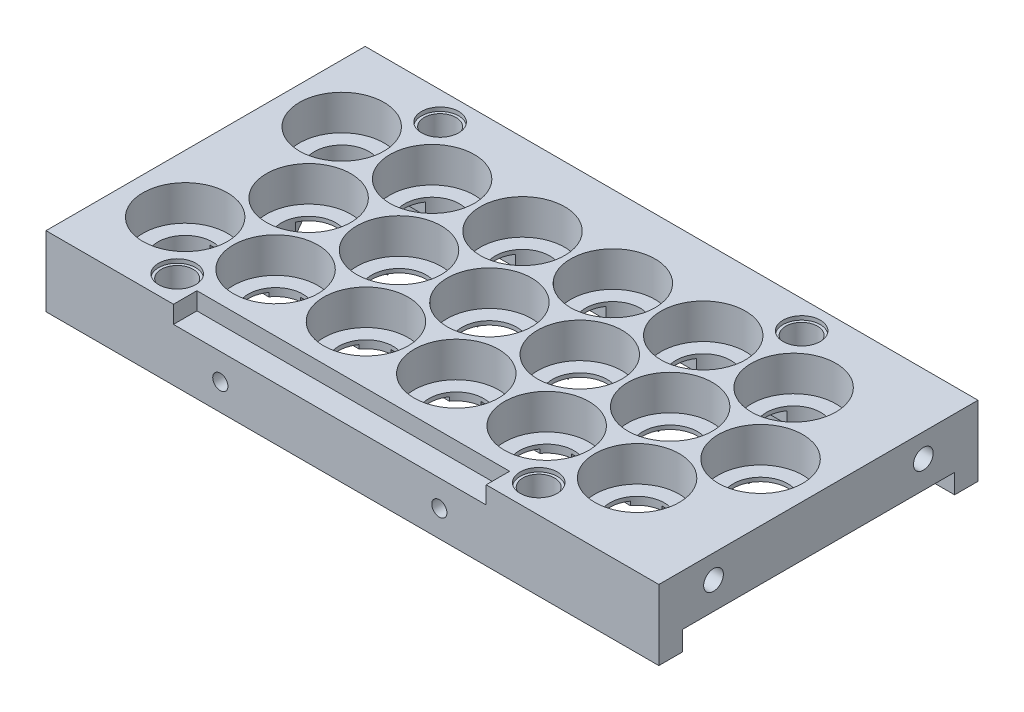
from build123d import *
from build123d.topology import SkipClean

# Parameters (mm, degrees)
SKETCH1_W            = 156.975
SKETCH1_H            = 81.746976195
SKETCH1_R            = 10.825
BOSS_EXTRUDE2_DEPTH  = 11
SKETCH1_3_R          = 10.825
SKETCH1_3_R_2        = 7
BOSS_EXTRUDE3_DEPTH  = 2
CUT_EXTRUDE1_DEPTH   = 1
CUT_EXTRUDE3_REACH   = 157.046
SKETCH9_R            = 4.0767
SKETCH10_R           = 4.7625
CUT_EXTRUDE4_DEPTH   = 1
SKETCH13_R           = 6.5
BOSS_EXTRUDE7_DEPTH  = 7
BOSS_EXTRUDE9_START  = 2
BOSS_EXTRUDE9_DEPTH  = 2
BOSS_EXTRUDE10_DEPTH = 2
SKETCH17_R           = 1.9431
CUT_EXTRUDE5_DEPTH   = 4
SKETCH19_W           = 80.1
SKETCH19_H           = 4.475
CUT_EXTRUDE6_DEPTH   = 6
SKETCH20_R           = 1.9431
CUT_EXTRUDE7_DEPTH   = 3.8862
SKETCH22_R           = 2.525
CUT_EXTRUDE8_DEPTH   = 3.81


with BuildPart() as part:
    # Sketch1 → Boss-Extrude2 (new body)
    with BuildSketch(Plane(origin=(0, 0, 0), x_dir=(1, 0, 0), z_dir=(0, 1, 0))):
        with Locations((63.6625, -20.048488098)):
            Rectangle(SKETCH1_W, SKETCH1_H)
        with Locations((0, -40.096976195)):
            Circle(SKETCH1_R, mode=Mode.SUBTRACT)
        with Locations((23.15, -40.096976195)):
            Circle(SKETCH1_R, mode=Mode.SUBTRACT)
        with Locations((46.3, -40.096976195)):
            Circle(SKETCH1_R, mode=Mode.SUBTRACT)
        with Locations((69.45, -40.096976195)):
            Circle(SKETCH1_R, mode=Mode.SUBTRACT)
        with Locations((92.6, -40.096976195)):
            Circle(SKETCH1_R, mode=Mode.SUBTRACT)
        with Locations((115.75, -40.096976195)):
            Circle(SKETCH1_R, mode=Mode.SUBTRACT)
        with Locations((11.575, -20.048488098)):
            Circle(SKETCH1_R, mode=Mode.SUBTRACT)
        Circle(SKETCH1_R, mode=Mode.SUBTRACT)
        with Locations((23.15, 0)):
            Circle(SKETCH1_R, mode=Mode.SUBTRACT)
        with Locations((34.725, -20.048488098)):
            Circle(SKETCH1_R, mode=Mode.SUBTRACT)
        with Locations((57.875, -20.048488098)):
            Circle(SKETCH1_R, mode=Mode.SUBTRACT)
        with Locations((46.3, 0)):
            Circle(SKETCH1_R, mode=Mode.SUBTRACT)
        with Locations((81.025, -20.048488098)):
            Circle(SKETCH1_R, mode=Mode.SUBTRACT)
        with Locations((69.45, 0)):
            Circle(SKETCH1_R, mode=Mode.SUBTRACT)
        with Locations((92.6, 0)):
            Circle(SKETCH1_R, mode=Mode.SUBTRACT)
        with Locations((104.175, -20.048488098)):
            Circle(SKETCH1_R, mode=Mode.SUBTRACT)
        with Locations((127.325, -20.048488098)):
            Circle(SKETCH1_R, mode=Mode.SUBTRACT)
        with Locations((115.75, 0)):
            Circle(SKETCH1_R, mode=Mode.SUBTRACT)
    extrude(amount=BOSS_EXTRUDE2_DEPTH)

    # Sketch1<3> → Boss-Extrude3 (add)
    # profile 1 of 18: a face of its own
    with BuildSketch(Plane(origin=(0, 0, 0), x_dir=(1, 0, 0), z_dir=(0, 1, 0))):
        Circle(SKETCH1_3_R)
        Circle(SKETCH1_3_R_2, mode=Mode.SUBTRACT)
    # profile 2 of 18: a face of its own
    with BuildSketch(Plane(origin=(0, 0, 0), x_dir=(1, 0, 0), z_dir=(0, 1, 0))):
        with Locations((11.575, -20.048488098)):
            Circle(SKETCH1_3_R)
        with Locations((11.575, -20.048488098)):
            Circle(SKETCH1_3_R_2, mode=Mode.SUBTRACT)
    # profile 3 of 18: a face of its own
    with BuildSketch(Plane(origin=(0, 0, 0), x_dir=(1, 0, 0), z_dir=(0, 1, 0))):
        with Locations((0, -40.096976195)):
            Circle(SKETCH1_3_R)
        with Locations((0, -40.096976195)):
            Circle(SKETCH1_3_R_2, mode=Mode.SUBTRACT)
    # profile 4 of 18: a face of its own
    with BuildSketch(Plane(origin=(0, 0, 0), x_dir=(1, 0, 0), z_dir=(0, 1, 0))):
        with Locations((23.15, 0)):
            Circle(SKETCH1_3_R)
        with Locations((23.15, 0)):
            Circle(SKETCH1_3_R_2, mode=Mode.SUBTRACT)
    # profile 5 of 18: a face of its own
    with BuildSketch(Plane(origin=(0, 0, 0), x_dir=(1, 0, 0), z_dir=(0, 1, 0))):
        with Locations((34.725, -20.048488098)):
            Circle(SKETCH1_3_R)
        with Locations((34.725, -20.048488098)):
            Circle(SKETCH1_3_R_2, mode=Mode.SUBTRACT)
    # profile 6 of 18: a face of its own
    with BuildSketch(Plane(origin=(0, 0, 0), x_dir=(1, 0, 0), z_dir=(0, 1, 0))):
        with Locations((23.15, -40.096976195)):
            Circle(SKETCH1_3_R)
        with Locations((23.15, -40.096976195)):
            Circle(SKETCH1_3_R_2, mode=Mode.SUBTRACT)
    # profile 7 of 18: a face of its own
    with BuildSketch(Plane(origin=(0, 0, 0), x_dir=(1, 0, 0), z_dir=(0, 1, 0))):
        with Locations((46.3, 0)):
            Circle(SKETCH1_3_R)
        with Locations((46.3, 0)):
            Circle(SKETCH1_3_R_2, mode=Mode.SUBTRACT)
    # profile 8 of 18: a face of its own
    with BuildSketch(Plane(origin=(0, 0, 0), x_dir=(1, 0, 0), z_dir=(0, 1, 0))):
        with Locations((57.875, -20.048488098)):
            Circle(SKETCH1_3_R)
        with Locations((57.875, -20.048488098)):
            Circle(SKETCH1_3_R_2, mode=Mode.SUBTRACT)
    # profile 9 of 18: a face of its own
    with BuildSketch(Plane(origin=(0, 0, 0), x_dir=(1, 0, 0), z_dir=(0, 1, 0))):
        with Locations((46.3, -40.096976195)):
            Circle(SKETCH1_3_R)
        with Locations((46.3, -40.096976195)):
            Circle(SKETCH1_3_R_2, mode=Mode.SUBTRACT)
    # profile 10 of 18: a face of its own
    with BuildSketch(Plane(origin=(0, 0, 0), x_dir=(1, 0, 0), z_dir=(0, 1, 0))):
        with Locations((69.45, 0)):
            Circle(SKETCH1_3_R)
        with Locations((69.45, 0)):
            Circle(SKETCH1_3_R_2, mode=Mode.SUBTRACT)
    # profile 11 of 18: a face of its own
    with BuildSketch(Plane(origin=(0, 0, 0), x_dir=(1, 0, 0), z_dir=(0, 1, 0))):
        with Locations((81.025, -20.048488098)):
            Circle(SKETCH1_3_R)
        with Locations((81.025, -20.048488098)):
            Circle(SKETCH1_3_R_2, mode=Mode.SUBTRACT)
    # profile 12 of 18: a face of its own
    with BuildSketch(Plane(origin=(0, 0, 0), x_dir=(1, 0, 0), z_dir=(0, 1, 0))):
        with Locations((69.45, -40.096976195)):
            Circle(SKETCH1_3_R)
        with Locations((69.45, -40.096976195)):
            Circle(SKETCH1_3_R_2, mode=Mode.SUBTRACT)
    # profile 13 of 18: a face of its own
    with BuildSketch(Plane(origin=(0, 0, 0), x_dir=(1, 0, 0), z_dir=(0, 1, 0))):
        with Locations((92.6, 0)):
            Circle(SKETCH1_3_R)
        with Locations((92.6, 0)):
            Circle(SKETCH1_3_R_2, mode=Mode.SUBTRACT)
    # profile 14 of 18: a face of its own
    with BuildSketch(Plane(origin=(0, 0, 0), x_dir=(1, 0, 0), z_dir=(0, 1, 0))):
        with Locations((104.175, -20.048488098)):
            Circle(SKETCH1_3_R)
        with Locations((104.175, -20.048488098)):
            Circle(SKETCH1_3_R_2, mode=Mode.SUBTRACT)
    # profile 15 of 18: a face of its own
    with BuildSketch(Plane(origin=(0, 0, 0), x_dir=(1, 0, 0), z_dir=(0, 1, 0))):
        with Locations((92.6, -40.096976195)):
            Circle(SKETCH1_3_R)
        with Locations((92.6, -40.096976195)):
            Circle(SKETCH1_3_R_2, mode=Mode.SUBTRACT)
    # profile 16 of 18: a face of its own
    with BuildSketch(Plane(origin=(0, 0, 0), x_dir=(1, 0, 0), z_dir=(0, 1, 0))):
        with Locations((115.75, 0)):
            Circle(SKETCH1_3_R)
        with Locations((115.75, 0)):
            Circle(SKETCH1_3_R_2, mode=Mode.SUBTRACT)
    # profile 17 of 18: a face of its own
    with BuildSketch(Plane(origin=(0, 0, 0), x_dir=(1, 0, 0), z_dir=(0, 1, 0))):
        with Locations((127.325, -20.048488098)):
            Circle(SKETCH1_3_R)
        with Locations((127.325, -20.048488098)):
            Circle(SKETCH1_3_R_2, mode=Mode.SUBTRACT)
    # profile 18 of 18: a face of its own
    with BuildSketch(Plane(origin=(0, 0, 0), x_dir=(1, 0, 0), z_dir=(0, 1, 0))):
        with Locations((115.75, -40.096976195)):
            Circle(SKETCH1_3_R)
        with Locations((115.75, -40.096976195)):
            Circle(SKETCH1_3_R_2, mode=Mode.SUBTRACT)
    extrude(amount=BOSS_EXTRUDE3_DEPTH)

    # Sketch2 → Cut-Extrude1 (cut)
    with BuildSketch(Plane.XZ):
        with BuildLine():
            Line((-0.591820292, 33.12203901), (5.238617062, 23.023425283))
            ThreePointArc((5.238617062, 23.023425283), (8.075, 26.110665924), (12.166820292, 27.023425283))
            Line((12.166820292, 27.023425283), (6.92820323, 36.096976195))
            Line((6.92820323, 36.096976195), (17.405437353, 36.096976195))
            ThreePointArc((17.405437353, 36.096976195), (16.15, 40.096976195), (17.405437353, 44.096976195))
            Line((17.405437353, 44.096976195), (5.744562647, 44.096976195))
            ThreePointArc((5.744562647, 44.096976195), (6.062177826, 36.596976195), (-0.591820292, 33.12203901))
        make_face()
        with BuildLine():
            Line((27.79679677, 24.048488098), (17.319562647, 24.048488098))
            ThreePointArc((17.319562647, 24.048488098), (18.575, 20.048488098), (17.319562647, 16.048488098))
            Line((17.319562647, 16.048488098), (27.79679677, 16.048488098))
            Line((27.79679677, 16.048488098), (22.558179708, 6.974937186))
            ThreePointArc((22.558179708, 6.974937186), (26.124937186, 6.336382938), (28.894562647, 4))
            Line((28.894562647, 4), (6.92820323, 4))
            Line((6.92820323, 4), (12.166820292, 13.073550912))
            ThreePointArc((12.166820292, 13.073550912), (8.075, 13.986310271), (5.238617062, 17.073550912))
            Line((5.238617062, 17.073550912), (-0.591820292, 6.974937186))
            ThreePointArc((-0.591820292, 6.974937186), (2.974937186, 6.336382938), (5.744562647, 4))
            Line((5.744562647, 4), (0, 4))
            ThreePointArc((0, 4), (-4, 0), (0, -4))
            Line((0, -4), (115.75, -4))
            ThreePointArc((115.75, -4), (119.75, 0), (115.75, 4))
            Line((115.75, 4), (99.52820323, 4))
            Line((99.52820323, 4), (104.766820292, 13.073550912))
            ThreePointArc((104.766820292, 13.073550912), (97.175, 20.048488098), (104.766820292, 27.023425283))
            Line((104.766820292, 27.023425283), (99.52820323, 36.096976195))
            Line((99.52820323, 36.096976195), (110.005437353, 36.096976195))
            ThreePointArc((110.005437353, 36.096976195), (108.75, 40.096976195), (110.005437353, 44.096976195))
            Line((110.005437353, 44.096976195), (98.344562647, 44.096976195))
            ThreePointArc((98.344562647, 44.096976195), (98.662177826, 36.596976195), (92.008179708, 33.12203901))
            Line((92.008179708, 33.12203901), (97.24679677, 24.048488098))
            Line((97.24679677, 24.048488098), (86.769562647, 24.048488098))
            ThreePointArc((86.769562647, 24.048488098), (88.025, 20.048488098), (86.769562647, 16.048488098))
            Line((86.769562647, 16.048488098), (97.24679677, 16.048488098))
            Line((97.24679677, 16.048488098), (92.008179708, 6.974937186))
            ThreePointArc((92.008179708, 6.974937186), (95.574937186, 6.336382938), (98.344562647, 4))
            Line((98.344562647, 4), (76.37820323, 4))
            Line((76.37820323, 4), (81.616820292, 13.073550912))
            ThreePointArc((81.616820292, 13.073550912), (74.025, 20.048488098), (81.616820292, 27.023425283))
            Line((81.616820292, 27.023425283), (76.37820323, 36.096976195))
            Line((76.37820323, 36.096976195), (86.855437353, 36.096976195))
            ThreePointArc((86.855437353, 36.096976195), (85.6, 40.096976195), (86.855437353, 44.096976195))
            Line((86.855437353, 44.096976195), (75.194562647, 44.096976195))
            ThreePointArc((75.194562647, 44.096976195), (75.512177826, 36.596976195), (68.858179708, 33.12203901))
            Line((68.858179708, 33.12203901), (74.09679677, 24.048488098))
            Line((74.09679677, 24.048488098), (63.619562647, 24.048488098))
            ThreePointArc((63.619562647, 24.048488098), (64.875, 20.048488098), (63.619562647, 16.048488098))
            Line((63.619562647, 16.048488098), (74.09679677, 16.048488098))
            Line((74.09679677, 16.048488098), (68.858179708, 6.974937186))
            ThreePointArc((68.858179708, 6.974937186), (72.424937186, 6.336382938), (75.194562647, 4))
            Line((75.194562647, 4), (53.22820323, 4))
            Line((53.22820323, 4), (58.466820292, 13.073550912))
            ThreePointArc((58.466820292, 13.073550912), (50.875, 20.048488098), (58.466820292, 27.023425283))
            Line((58.466820292, 27.023425283), (53.22820323, 36.096976195))
            Line((53.22820323, 36.096976195), (63.705437353, 36.096976195))
            ThreePointArc((63.705437353, 36.096976195), (62.45, 40.096976195), (63.705437353, 44.096976195))
            Line((63.705437353, 44.096976195), (52.044562647, 44.096976195))
            ThreePointArc((52.044562647, 44.096976195), (52.362177826, 36.596976195), (45.708179708, 33.12203901))
            Line((45.708179708, 33.12203901), (50.94679677, 24.048488098))
            Line((50.94679677, 24.048488098), (40.469562647, 24.048488098))
            ThreePointArc((40.469562647, 24.048488098), (41.725, 20.048488098), (40.469562647, 16.048488098))
            Line((40.469562647, 16.048488098), (50.94679677, 16.048488098))
            Line((50.94679677, 16.048488098), (45.708179708, 6.974937186))
            ThreePointArc((45.708179708, 6.974937186), (49.274937186, 6.336382938), (52.044562647, 4))
            Line((52.044562647, 4), (30.07820323, 4))
            Line((30.07820323, 4), (35.316820292, 13.073550912))
            ThreePointArc((35.316820292, 13.073550912), (27.725, 20.048488098), (35.316820292, 27.023425283))
            Line((35.316820292, 27.023425283), (30.07820323, 36.096976195))
            Line((30.07820323, 36.096976195), (40.555437353, 36.096976195))
            ThreePointArc((40.555437353, 36.096976195), (39.3, 40.096976195), (40.555437353, 44.096976195))
            Line((40.555437353, 44.096976195), (28.894562647, 44.096976195))
            ThreePointArc((28.894562647, 44.096976195), (29.212177826, 36.596976195), (22.558179708, 33.12203901))
            Line((22.558179708, 33.12203901), (27.79679677, 24.048488098))
        make_face()
        with BuildLine():
            Line((127.916820292, 27.023425283), (122.086382938, 37.12203901))
            ThreePointArc((122.086382938, 37.12203901), (119.25, 34.034798369), (115.158179708, 33.12203901))
            Line((115.158179708, 33.12203901), (120.39679677, 24.048488098))
            Line((120.39679677, 24.048488098), (109.919562647, 24.048488098))
            ThreePointArc((109.919562647, 24.048488098), (111.175, 20.048488098), (109.919562647, 16.048488098))
            Line((109.919562647, 16.048488098), (120.39679677, 16.048488098))
            Line((120.39679677, 16.048488098), (115.158179708, 6.974937186))
            ThreePointArc((115.158179708, 6.974937186), (119.25, 6.062177826), (122.086382938, 2.974937186))
            Line((122.086382938, 2.974937186), (127.916820292, 13.073550912))
            ThreePointArc((127.916820292, 13.073550912), (120.325, 20.048488098), (127.916820292, 27.023425283))
        make_face()
    extrude(amount=-CUT_EXTRUDE1_DEPTH, mode=Mode.SUBTRACT)

    # Sketch9 → Cut-Extrude3 (cut, up to next)
    with BuildSketch(Plane(origin=(0, 11, 0), x_dir=(1, 0, 0), z_dir=(0, 1, 0)), mode=Mode.PRIVATE) as cut_extrude3_sk1:
        with Locations((11.575, 13.625)):
            Circle(SKETCH9_R)
    cut_extrude3_tool1 = extrude(cut_extrude3_sk1.sketch, amount=-CUT_EXTRUDE3_REACH, mode=Mode.PRIVATE) & part.part
    # Sketch9 → Cut-Extrude3 (cut, up to next)
    with BuildSketch(Plane(origin=(0, 11, 0), x_dir=(1, 0, 0), z_dir=(0, 1, 0)), mode=Mode.PRIVATE) as cut_extrude3_sk2:
        with Locations((11.575, -53.721976195)):
            Circle(SKETCH9_R)
    cut_extrude3_tool2 = extrude(cut_extrude3_sk2.sketch, amount=-CUT_EXTRUDE3_REACH, mode=Mode.PRIVATE) & part.part
    # Sketch9 → Cut-Extrude3 (cut, up to next)
    with BuildSketch(Plane(origin=(0, 11, 0), x_dir=(1, 0, 0), z_dir=(0, 1, 0)), mode=Mode.PRIVATE) as cut_extrude3_sk3:
        with Locations((104.175, -53.721976195)):
            Circle(SKETCH9_R)
    cut_extrude3_tool3 = extrude(cut_extrude3_sk3.sketch, amount=-CUT_EXTRUDE3_REACH, mode=Mode.PRIVATE) & part.part
    # Sketch9 → Cut-Extrude3 (cut, up to next)
    with BuildSketch(Plane(origin=(0, 11, 0), x_dir=(1, 0, 0), z_dir=(0, 1, 0)), mode=Mode.PRIVATE) as cut_extrude3_sk4:
        with Locations((104.175, 13.625)):
            Circle(SKETCH9_R)
    cut_extrude3_tool4 = extrude(cut_extrude3_sk4.sketch, amount=-CUT_EXTRUDE3_REACH, mode=Mode.PRIVATE) & part.part
    add(cut_extrude3_tool1.solids().sort_by_distance((11.575, 11, -13.625))[0], mode=Mode.SUBTRACT)
    add(cut_extrude3_tool2.solids().sort_by_distance((11.575, 11, 53.721976))[0], mode=Mode.SUBTRACT)
    add(cut_extrude3_tool3.solids().sort_by_distance((104.175, 11, 53.721976))[0], mode=Mode.SUBTRACT)
    add(cut_extrude3_tool4.solids().sort_by_distance((104.175, 11, -13.625))[0], mode=Mode.SUBTRACT)

    # Sketch10 → Cut-Extrude4 (cut)
    with BuildSketch(Plane(origin=(0, 11, 0), x_dir=(1, 0, 0), z_dir=(0, 1, 0))):
        with Locations((11.575, 13.625)):
            Circle(SKETCH10_R)
        with Locations((104.175, 13.625)):
            Circle(SKETCH10_R)
        with Locations((104.175, -53.721976195)):
            Circle(SKETCH10_R)
        with Locations((11.575, -53.721976195)):
            Circle(SKETCH10_R)
    extrude(amount=-CUT_EXTRUDE4_DEPTH, mode=Mode.SUBTRACT)

    # Sketch13 → Boss-Extrude7 (add)
    # profile 1 of 2: a face of its own
    with BuildSketch(Plane.XZ):
        with BuildLine():
            ThreePointArc((3.665512027, 54.921976195), (11.575, 45.721976195), (19.484487973, 54.921976195))
            Line((19.484487973, 54.921976195), (96.265512027, 54.921976195))
            ThreePointArc((96.265512027, 54.921976195), (104.175, 45.721976195), (112.084487973, 54.921976195))
            Line((112.084487973, 54.921976195), (142.15, 54.921976195))
            Line((142.15, 54.921976195), (142.15, 60.921976195))
            Line((142.15, 60.921976195), (-14.825, 60.921976195))
            Line((-14.825, 60.921976195), (-14.825, 54.921976195))
            Line((-14.825, 54.921976195), (3.665512027, 54.921976195))
        make_face()
        with Locations((11.575, 53.721976195)):
            Circle(SKETCH13_R, mode=Mode.SUBTRACT)
        with Locations((104.175, 53.721976195)):
            Circle(SKETCH13_R, mode=Mode.SUBTRACT)
    # profile 2 of 2: a face of its own
    with BuildSketch(Plane.XZ):
        with BuildLine():
            Line((-14.825, -14.825), (-14.825, -20.825))
            Line((-14.825, -20.825), (142.15, -20.825))
            Line((142.15, -20.825), (142.15, -14.825))
            Line((142.15, -14.825), (112.084487973, -14.825))
            ThreePointArc((112.084487973, -14.825), (104.175, -5.625), (96.265512027, -14.825))
            Line((96.265512027, -14.825), (19.484487973, -14.825))
            ThreePointArc((19.484487973, -14.825), (11.575, -5.625), (3.665512027, -14.825))
            Line((3.665512027, -14.825), (-14.825, -14.825))
        make_face()
        with Locations((11.575, -13.625)):
            Circle(SKETCH13_R, mode=Mode.SUBTRACT)
        with Locations((104.175, -13.625)):
            Circle(SKETCH13_R, mode=Mode.SUBTRACT)
    extrude(amount=BOSS_EXTRUDE7_DEPTH)

    # Sketch14 → Boss-Extrude9 (add)
    with SkipClean():  # the faces are left unmerged after this step: merging them gives an invalid solid
        with BuildSketch(Plane.XZ.offset(BOSS_EXTRUDE9_START)):
            with BuildLine():
                Line((142.15, 54.921976195), (142.15, -14.825))
                Line((142.15, -14.825), (112.084487973, -14.825))
                ThreePointArc((112.084487973, -14.825), (104.175, -5.625), (96.265512027, -14.825))
                Line((96.265512027, -14.825), (19.484487973, -14.825))
                ThreePointArc((19.484487973, -14.825), (11.575, -5.625), (3.665512027, -14.825))
                Line((3.665512027, -14.825), (-14.825, -14.825))
                Line((-14.825, -14.825), (-14.825, 54.921976195))
                Line((-14.825, 54.921976195), (3.665512027, 54.921976195))
                ThreePointArc((3.665512027, 54.921976195), (11.575, 45.721976195), (19.484487973, 54.921976195))
                Line((19.484487973, 54.921976195), (96.265512027, 54.921976195))
                ThreePointArc((96.265512027, 54.921976195), (104.175, 45.721976195), (112.084487973, 54.921976195))
                Line((112.084487973, 54.921976195), (142.15, 54.921976195))
            make_face()
            with BuildLine():
                Line((5.238617062, 17.073550912), (-0.591820292, 6.974937186))
                ThreePointArc((-0.591820292, 6.974937186), (-6.062177826, -3.5), (5.744562647, -4))
                Line((5.744562647, -4), (17.405437353, -4))
                ThreePointArc((17.405437353, -4), (23.15, -7), (28.894562647, -4))
                Line((28.894562647, -4), (40.555437353, -4))
                ThreePointArc((40.555437353, -4), (46.3, -7), (52.044562647, -4))
                Line((52.044562647, -4), (63.705437353, -4))
                ThreePointArc((63.705437353, -4), (69.45, -7), (75.194562647, -4))
                Line((75.194562647, -4), (86.855437353, -4))
                ThreePointArc((86.855437353, -4), (92.6, -7), (98.344562647, -4))
                Line((98.344562647, -4), (110.005437353, -4))
                ThreePointArc((110.005437353, -4), (119.25, -6.062177826), (122.086382938, 2.974937186))
                Line((122.086382938, 2.974937186), (127.916820292, 13.073550912))
                ThreePointArc((127.916820292, 13.073550912), (134.325, 20.048488098), (127.916820292, 27.023425283))
                Line((127.916820292, 27.023425283), (122.086382938, 37.12203901))
                ThreePointArc((122.086382938, 37.12203901), (119.25, 46.159154022), (110.005437353, 44.096976195))
                Line((110.005437353, 44.096976195), (98.344562647, 44.096976195))
                ThreePointArc((98.344562647, 44.096976195), (92.6, 47.096976195), (86.855437353, 44.096976195))
                Line((86.855437353, 44.096976195), (75.194562647, 44.096976195))
                ThreePointArc((75.194562647, 44.096976195), (69.45, 47.096976195), (63.705437353, 44.096976195))
                Line((63.705437353, 44.096976195), (52.044562647, 44.096976195))
                ThreePointArc((52.044562647, 44.096976195), (46.3, 47.096976195), (40.555437353, 44.096976195))
                Line((40.555437353, 44.096976195), (28.894562647, 44.096976195))
                ThreePointArc((28.894562647, 44.096976195), (23.15, 47.096976195), (17.405437353, 44.096976195))
                Line((17.405437353, 44.096976195), (5.744562647, 44.096976195))
                ThreePointArc((5.744562647, 44.096976195), (-6.062177826, 43.596976195), (-0.591820292, 33.12203901))
                Line((-0.591820292, 33.12203901), (5.238617062, 23.023425283))
                ThreePointArc((5.238617062, 23.023425283), (4.575, 20.048488098), (5.238617062, 17.073550912))
            make_face(mode=Mode.SUBTRACT)
        extrude(amount=-BOSS_EXTRUDE9_DEPTH)

    # Sketch16 → Boss-Extrude10 (add)
    with SkipClean():  # the faces are left unmerged after this step: merging them gives an invalid solid
        with BuildSketch(Plane.XZ):
            with BuildLine():
                Line((15.536128823, 32.859238845), (20.688871177, 29.884301659))
                ThreePointArc((20.688871177, 29.884301659), (21.237909283, 27.835263554), (19.188871177, 27.286225448))
                Line((19.188871177, 27.286225448), (14.036128823, 30.261162634))
                ThreePointArc((14.036128823, 30.261162634), (13.487090717, 32.310200739), (15.536128823, 32.859238845))
            make_face()
            with BuildLine():
                Line((38.686128823, 32.859238845), (43.838871177, 29.884301659))
                ThreePointArc((43.838871177, 29.884301659), (44.387909283, 27.835263554), (42.338871177, 27.286225448))
                Line((42.338871177, 27.286225448), (37.186128823, 30.261162634))
                ThreePointArc((37.186128823, 30.261162634), (36.637090717, 32.310200739), (38.686128823, 32.859238845))
            make_face()
            with BuildLine():
                Line((61.836128823, 32.859238845), (66.988871177, 29.884301659))
                ThreePointArc((66.988871177, 29.884301659), (67.537909283, 27.835263554), (65.488871177, 27.286225448))
                Line((65.488871177, 27.286225448), (60.336128823, 30.261162634))
                ThreePointArc((60.336128823, 30.261162634), (59.787090717, 32.310200739), (61.836128823, 32.859238845))
            make_face()
            with BuildLine():
                Line((84.986128823, 32.859238845), (90.138871177, 29.884301659))
                ThreePointArc((90.138871177, 29.884301659), (90.687909283, 27.835263554), (88.638871177, 27.286225448))
                Line((88.638871177, 27.286225448), (83.486128823, 30.261162634))
                ThreePointArc((83.486128823, 30.261162634), (82.937090717, 32.310200739), (84.986128823, 32.859238845))
            make_face()
            with BuildLine():
                Line((108.136128823, 32.859238845), (113.288871177, 29.884301659))
                ThreePointArc((113.288871177, 29.884301659), (113.837909283, 27.835263554), (111.788871177, 27.286225448))
                Line((111.788871177, 27.286225448), (106.636128823, 30.261162634))
                ThreePointArc((106.636128823, 30.261162634), (106.087090717, 32.310200739), (108.136128823, 32.859238845))
            make_face()
            with BuildLine():
                Line((15.536128823, 7.23773735), (20.688871177, 10.212674536))
                ThreePointArc((20.688871177, 10.212674536), (21.237909283, 12.261712642), (19.188871177, 12.810750747))
                Line((19.188871177, 12.810750747), (14.036128823, 9.835813562))
                ThreePointArc((14.036128823, 9.835813562), (13.487090717, 7.786775456), (15.536128823, 7.23773735))
            make_face()
            with BuildLine():
                Line((38.686128823, 7.23773735), (43.838871177, 10.212674536))
                ThreePointArc((43.838871177, 10.212674536), (44.387909283, 12.261712642), (42.338871177, 12.810750747))
                Line((42.338871177, 12.810750747), (37.186128823, 9.835813562))
                ThreePointArc((37.186128823, 9.835813562), (36.637090717, 7.786775456), (38.686128823, 7.23773735))
            make_face()
            with BuildLine():
                Line((61.836128823, 7.23773735), (66.988871177, 10.212674536))
                ThreePointArc((66.988871177, 10.212674536), (67.537909283, 12.261712642), (65.488871177, 12.810750747))
                Line((65.488871177, 12.810750747), (60.336128823, 9.835813562))
                ThreePointArc((60.336128823, 9.835813562), (59.787090717, 7.786775456), (61.836128823, 7.23773735))
            make_face()
            with BuildLine():
                Line((84.986128823, 7.23773735), (90.138871177, 10.212674536))
                ThreePointArc((90.138871177, 10.212674536), (90.687909283, 12.261712642), (88.638871177, 12.810750747))
                Line((88.638871177, 12.810750747), (83.486128823, 9.835813562))
                ThreePointArc((83.486128823, 9.835813562), (82.937090717, 7.786775456), (84.986128823, 7.23773735))
            make_face()
            with BuildLine():
                Line((108.136128823, 7.23773735), (113.288871177, 10.212674536))
                ThreePointArc((113.288871177, 10.212674536), (113.837909283, 12.261712642), (111.788871177, 12.810750747))
                Line((111.788871177, 12.810750747), (106.636128823, 9.835813562))
                ThreePointArc((106.636128823, 9.835813562), (106.087090717, 7.786775456), (108.136128823, 7.23773735))
            make_face()
        extrude(amount=BOSS_EXTRUDE10_DEPTH)

    # Sketch17 → Cut-Extrude5 (cut)
    with BuildSketch(Plane(origin=(0, -2, 0), x_dir=(-1, 0, 0), z_dir=(0, -1, 0))):
        with Locations((8.825, -49.509476195)):
            Circle(SKETCH17_R)
        with Locations((-57.875, -49.509476195)):
            Circle(SKETCH17_R)
        with Locations((-132.15, -49.509476195)):
            Circle(SKETCH17_R)
        with Locations((-132.15, 9.4125)):
            Circle(SKETCH17_R)
        with Locations((-57.875, 9.4125)):
            Circle(SKETCH17_R)
        with Locations((8.825, 9.4125)):
            Circle(SKETCH17_R)
    extrude(amount=-CUT_EXTRUDE5_DEPTH, mode=Mode.SUBTRACT)

    # Sketch19 → Cut-Extrude6 (cut)
    with BuildSketch(Plane.XY.offset(60.921976195)):
        with Locations((57.875, 8.7625)):
            Rectangle(SKETCH19_W, SKETCH19_H)
    extrude(amount=-CUT_EXTRUDE6_DEPTH, mode=Mode.SUBTRACT)

    # Sketch20 → Cut-Extrude7 (cut)
    with BuildSketch(Plane.XY.offset(60.921976195)):
        with Locations((29.825, -0.2375)):
            Circle(SKETCH20_R)
        with Locations((85.925, -0.2375)):
            Circle(SKETCH20_R)
    extrude(amount=-CUT_EXTRUDE7_DEPTH, mode=Mode.SUBTRACT)

    # Sketch22 → Cut-Extrude8 (cut)
    with BuildSketch(Plane(origin=(142.15, 0, 0), x_dir=(0, 0, -1), z_dir=(1, 0, 0))):
        with Locations((-46.921976195, 5)):
            Circle(SKETCH22_R)
        with Locations((6.825, 5)):
            Circle(SKETCH22_R)
    extrude(amount=-CUT_EXTRUDE8_DEPTH, mode=Mode.SUBTRACT)


solid = part.part
